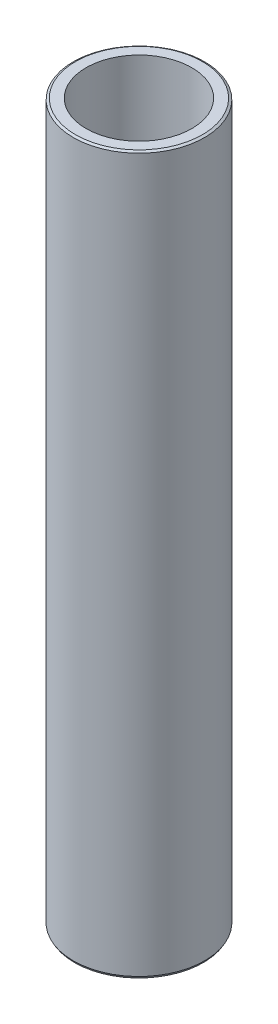
from build123d import *
from OCP.BRepFilletAPI import BRepFilletAPI_MakeChamfer

# Parameters (mm, degrees)
SKETCH1_R           = 55
BOSS_EXTRUDE1_DEPTH = 600
SKETCH2_R           = 44.252085471
CUT_EXTRUDE1_DEPTH  = 606.020660804
CHAMFER1_SIZE       = 1.087348665
CHAMFER1_SIZE2      = 1.883343133


with BuildPart() as part:
    # Sketch1 → Boss-Extrude1 (new body)
    with BuildSketch(Plane(origin=(0, 0, 0), x_dir=(1, 0, 0), z_dir=(0, 1, 0))):
        Circle(SKETCH1_R)
    extrude(amount=BOSS_EXTRUDE1_DEPTH)

    # Sketch2 → Cut-Extrude1 (cut, through all)
    with BuildSketch(Plane(origin=(0, 0, 0), x_dir=(1, 0, 0), z_dir=(0, 1, 0))):
        Circle(SKETCH2_R)
    extrude(amount=CUT_EXTRUDE1_DEPTH, mode=Mode.SUBTRACT)

    # Chamfer1: one chamfer whose edges measure the first distance from different faces: ONE call of the kernel's chamfer builder (chamfer() names one face for all edges)
    chamfer1_edges_1 = [part.edges().sort_by_distance(p)[0] for p in [
        (-55, 600, 0),
    ]]
    chamfer1_side_1 = [part.faces().sort_by_distance(p)[0] for p in [
        (-55, 300, 0),
    ]]
    chamfer1_edges_2 = [part.edges().sort_by_distance(p)[0] for p in [
        (-55, 0, 0),
    ]]
    chamfer1_side_2 = [part.faces().sort_by_distance(p)[0] for p in [
        (-53.444365081, 0, 0),
    ]]
    chamfer1 = BRepFilletAPI_MakeChamfer(part.part.solid().wrapped)
    for e in chamfer1_edges_1:
        chamfer1.Add(CHAMFER1_SIZE, CHAMFER1_SIZE2, e.wrapped, chamfer1_side_1[0].wrapped)  # the first distance lies on this face
    for e in chamfer1_edges_2:
        chamfer1.Add(CHAMFER1_SIZE, CHAMFER1_SIZE2, e.wrapped, chamfer1_side_2[0].wrapped)  # the first distance lies on this face
    add(Compound.cast(chamfer1.Shape()), mode=Mode.REPLACE)


solid = part.part
